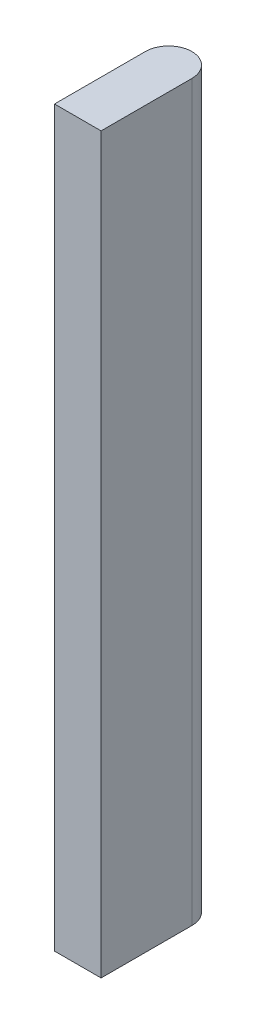
from build123d import *

# Parameters (mm, degrees)
BOSS_EXTRU_1_DEPTH = 31.5


with BuildPart() as part:
    # Esquisse1 → Boss.-Extru.1 (new body)
    with BuildSketch(Plane(origin=(0, 0, 0), x_dir=(1, 0, 0), z_dir=(0, 1, 0))):
        with BuildLine():
            Line((-1, -2.45), (1, -2.45))
            Line((1, -2.45), (1, 1.45))
            ThreePointArc((1, 1.45), (0, 2.45), (-1, 1.45))
            Line((-1, 1.45), (-1, -2.45))
        make_face()
    extrude(amount=BOSS_EXTRU_1_DEPTH)


solid = part.part
